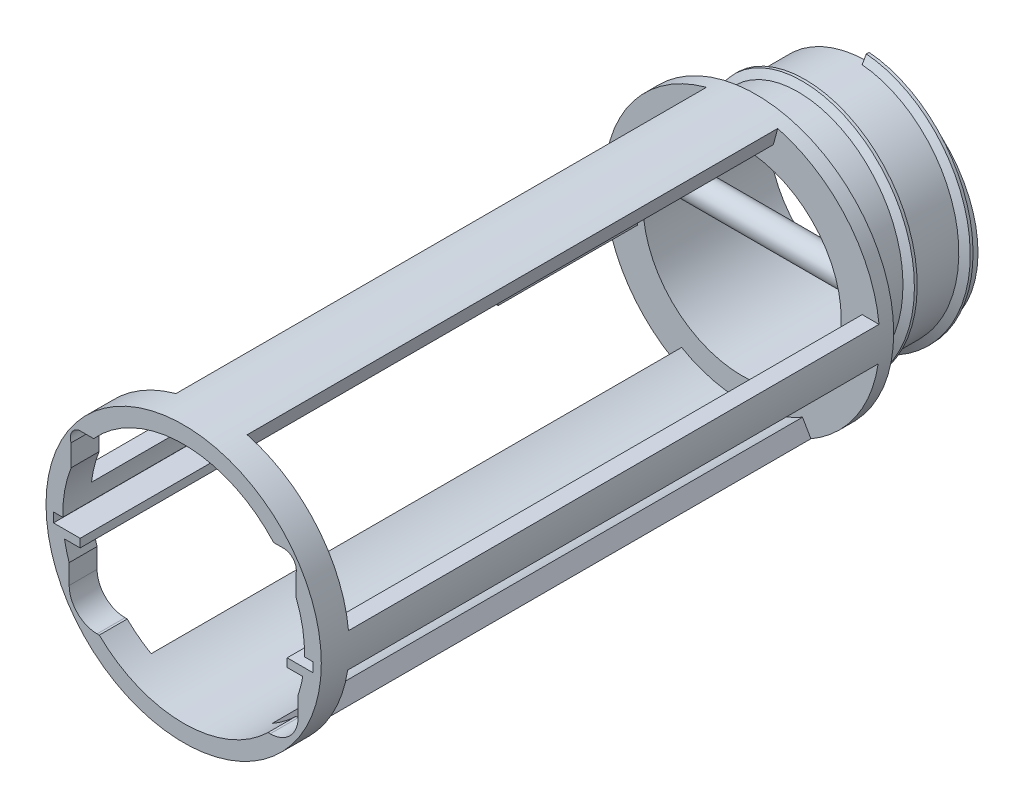
from build123d import *
from build123d.topology import SkipClean

# Parameters (mm, degrees)
SKETCH1_R                             = 19.75
SKETCH1_R_2                           = 17.75
BOSS_EXTRUDE1_DEPTH                   = 20
SKETCH2_R                             = 24.65
SKETCH2_R_2                           = 17.75
BOSS_EXTRUDE2_DEPTH                   = 2.5
SKETCH15_R                            = 24.65
SKETCH15_R_2                          = 21.65
BOSS_EXTRUDE3_DEPTH                   = 100
CUT_EXTRUDE2_START                    = -5
CUT_EXTRUDE2_DEPTH                    = 95
BOSS_EXTRUDE5_DEPTH                   = 100
SKETCH18_W                            = 46.5
SKETCH18_H                            = 1.7
CUT_EXTRUDE6_DEPTH                    = 100
BOSS_EXTRUDE11_DEPTH                  = 25
BOSS_EXTRUDE12_START                  = -100
BOSS_EXTRUDE12_DEPTH                  = 25
BOSS_EXTRUDE13_DEPTH                  = 100
CUT_EXTRUDE12_DEPTH                   = 5
CUT_EXTRUDE13_DEPTH                   = 5
BOSS_EXTRUDE16_DEPTH                  = 100
BOSS_EXTRUDE17_REACH                  = 129.364
BOSS_EXTRUDE17_END_RADIUS             = 17.75
SKETCH27_R                            = 2.3
BOSS_EXTRUDE17_DIRECTION_2_REACH      = 129.364
BOSS_EXTRUDE17_DIRECTION_2_END_RADIUS = 17.75
SWEEP1_PITCH                          = 10


with BuildPart() as part:
    # Sketch1 → Boss-Extrude1 (new body)
    with BuildSketch(Plane.XY):
        Circle(SKETCH1_R)
        Circle(SKETCH1_R_2, mode=Mode.SUBTRACT)
    extrude(amount=BOSS_EXTRUDE1_DEPTH)

    # Boss-Extrude17: up to this cylinder (the profile starts inside it)
    boss_extrude17_end = Plane(origin=(0, 0, 15), z_dir=(0, 0, -1)) * Cylinder(BOSS_EXTRUDE17_END_RADIUS, 295.228, mode=Mode.PRIVATE)
    # Sketch27 → Boss-Extrude17 (add, up to the surface)
    with BuildSketch(Plane(origin=(0, 0, 0), x_dir=(0, 0, -1), z_dir=(1, 0, 0)), mode=Mode.PRIVATE) as boss_extrude17_sk1:
        with Locations((-15, 0)):
            Circle(SKETCH27_R)
    boss_extrude17_tool1 = extrude(boss_extrude17_sk1.sketch, amount=BOSS_EXTRUDE17_REACH, mode=Mode.PRIVATE) & boss_extrude17_end
    add(boss_extrude17_tool1.solids().sort_by_distance((0, 0, 15))[0])

    # Boss-Extrude17 direction 2: up to this cylinder (the profile starts inside it)
    boss_extrude17_direction_2_end = Plane(origin=(0, 0, 15), z_dir=(0, 0, -1)) * Cylinder(BOSS_EXTRUDE17_DIRECTION_2_END_RADIUS, 295.228, mode=Mode.PRIVATE)
    # Sketch27 → Boss-Extrude17 direction 2 (add, up to the surface)
    with BuildSketch(Plane(origin=(0, 0, 0), x_dir=(0, 0, -1), z_dir=(1, 0, 0)), mode=Mode.PRIVATE) as boss_extrude17_direction_2_sk1:
        with Locations((-15, 0)):
            Circle(SKETCH27_R)
    boss_extrude17_direction_2_tool1 = extrude(boss_extrude17_direction_2_sk1.sketch, amount=-BOSS_EXTRUDE17_DIRECTION_2_REACH, mode=Mode.PRIVATE) & boss_extrude17_direction_2_end
    add(boss_extrude17_direction_2_tool1.solids().sort_by_distance((0, 0, 15))[0])



with BuildPart() as body_2:
    # Sketch2 → Boss-Extrude2 (new body)
    with BuildSketch(Plane.XY.offset(20)):
        Circle(SKETCH2_R)
        Circle(SKETCH2_R_2, mode=Mode.SUBTRACT)
    extrude(amount=BOSS_EXTRUDE2_DEPTH)

    # Sketch15 → Boss-Extrude3 (add)
    with BuildSketch(Plane.XY.offset(22.5)):
        Circle(SKETCH15_R)
        Circle(SKETCH15_R_2, mode=Mode.SUBTRACT)
    extrude(amount=BOSS_EXTRUDE3_DEPTH)

    # Sketch16 → Cut-Extrude2 (cut)
    with BuildSketch(Plane.XY.offset(122.5).offset(CUT_EXTRUDE2_START)):
        with BuildLine():
            Line((-24.522897463, -2.5), (-21.505173796, -2.5))
            ThreePointArc((-21.505173796, -2.5), (0, -21.65), (21.505173796, -2.5))
            Line((21.505173796, -2.5), (24.522897463, -2.5))
            ThreePointArc((24.522897463, -2.5), (0, -24.65), (-24.522897463, -2.5))
        make_face()
        with BuildLine():
            Line((-24.522897463, 2.5), (-21.505173796, 2.5))
            ThreePointArc((-21.505173796, 2.5), (0, 21.65), (21.505173796, 2.5))
            Line((21.505173796, 2.5), (24.522897463, 2.5))
            ThreePointArc((24.522897463, 2.5), (0, 24.65), (-24.522897463, 2.5))
        make_face()
    extrude(amount=-CUT_EXTRUDE2_DEPTH, mode=Mode.SUBTRACT)

    # Sketch19 → Boss-Extrude5 (add)
    with BuildSketch(Plane.XY.offset(122.5)):
        with BuildLine():
            Line((-12.325, -21.347526203), (-10.825, -18.749449992))
            ThreePointArc((-10.825, -18.749449992), (0, -21.65), (10.825, -18.749449992))
            Line((10.825, -18.749449992), (12.325, -21.347526203))
            ThreePointArc((12.325, -21.347526203), (0, -24.65), (-12.325, -21.347526203))
        make_face()
    extrude(amount=-BOSS_EXTRUDE5_DEPTH)

    # Sketch18 → Cut-Extrude6 (cut)
    with BuildSketch(Plane.XY.offset(122.5)):
        with Locations((-0.057052831, -1.356025124)):
            Rectangle(SKETCH18_W, SKETCH18_H)
    extrude(amount=-CUT_EXTRUDE6_DEPTH, mode=Mode.SUBTRACT)

    # Sketch22 → Boss-Extrude11 (add)
    with SkipClean():  # the faces are left unmerged after this step: merging them gives an invalid solid
        with BuildSketch(Plane.XY.offset(122.5)):
            with BuildLine():
                Line((-21.537315365, -2.206025124), (-18.537315365, -2.206025124))
                Line((-18.537315365, -2.206025124), (-18.537315365, -3.706025124))
                Line((-18.537315365, -3.706025124), (-21.330444857, -3.706025124))
                ThreePointArc((-21.330444857, -3.706025124), (-21.446997846, -2.957834239), (-21.537315365, -2.206025124))
            make_face()
            with BuildLine():
                Line((18.537315365, -3.706025124), (21.330444857, -3.706025124))
                ThreePointArc((21.330444857, -3.706025124), (21.446997846, -2.957834239), (21.537315365, -2.206025124))
                Line((21.537315365, -2.206025124), (18.537315365, -2.206025124))
                Line((18.537315365, -2.206025124), (18.537315365, -3.706025124))
            make_face()
        extrude(amount=-BOSS_EXTRUDE11_DEPTH)

    # Sketch23 → Boss-Extrude12 (add)
    with SkipClean():  # the faces are left unmerged after this step: merging them gives an invalid solid
        with BuildSketch(Plane.XY.offset(122.5).offset(BOSS_EXTRUDE12_START)):
            with BuildLine():
                Line((-22.693026531, -2.206025124), (-18.693026531, -2.206025124))
                Line((-18.693026531, -2.206025124), (-18.693026531, -3.706025124))
                Line((-18.693026531, -3.706025124), (-22.496785943, -3.706025124))
                ThreePointArc((-22.496785943, -3.706025124), (-22.607350306, -2.957653145), (-22.693026531, -2.206025124))
            make_face()
            with BuildLine():
                Line((18.693025877, -3.706025124), (22.496785943, -3.706025124))
                ThreePointArc((22.496785943, -3.706025124), (22.607350306, -2.957653145), (22.693026531, -2.206025124))
                Line((22.693026531, -2.206025124), (18.693026531, -2.206025124))
                Line((18.693026531, -2.206025124), (18.693025877, -3.706025124))
            make_face()
        extrude(amount=BOSS_EXTRUDE12_DEPTH)

    # Sketch26 → Boss-Extrude13 (add)
    with SkipClean():  # the faces are left unmerged after this step: merging them gives an invalid solid
        with BuildSketch(Plane.XY.offset(122.5)):
            with BuildLine():
                ThreePointArc((-24.644805509, -0.506025124), (-24.559483977, -2.110508655), (-24.36981489, -3.706025124))
                Line((-24.36981489, -3.706025124), (-22.496785943, -3.706025124))
                ThreePointArc((-22.496785943, -3.706025124), (-22.607350306, -2.957653145), (-22.693026531, -2.206025124))
                Line((-22.693026531, -2.206025124), (-23.307052831, -2.206025124))
                Line((-23.307052831, -2.206025124), (-23.307052831, -0.506025124))
                Line((-23.307052831, -0.506025124), (-24.644805509, -0.506025124))
            make_face()
            with BuildLine():
                ThreePointArc((22.693026531, -2.206025124), (22.607350306, -2.957653145), (22.496785943, -3.706025124))
                Line((22.496785943, -3.706025124), (24.36981489, -3.706025124))
                ThreePointArc((24.36981489, -3.706025124), (24.559483977, -2.110508655), (24.644805509, -0.506025124))
                Line((24.644805509, -0.506025124), (23.192947169, -0.506025124))
                Line((23.192947169, -0.506025124), (23.192947169, -2.206025124))
                Line((23.192947169, -2.206025124), (22.693026531, -2.206025124))
            make_face()
        extrude(amount=-BOSS_EXTRUDE13_DEPTH)

    # Sketch33 → Cut-Extrude12 (cut)
    with SkipClean():  # the faces are left unmerged after this step: merging them gives an invalid solid
        with BuildSketch(Plane.XY.offset(122.5)):
            with BuildLine():
                Line((-20.5, -10.506025124), (-20.5, -5.506025124))
                Line((-20.5, -5.506025124), (-15.5, -5.506025124))
                Line((-15.5, -5.506025124), (15.5, -5.506025124))
                Line((15.5, -5.506025124), (20.5, -5.506025124))
                Line((20.5, -5.506025124), (20.5, -10.506025124))
                ThreePointArc((20.5, -10.506025124), (19.035533906, -14.04155903), (15.5, -15.506025124))
                Line((15.5, -15.506025124), (-15.5, -15.506025124))
                ThreePointArc((-15.5, -15.506025124), (-19.035533906, -14.04155903), (-20.5, -10.506025124))
            make_face()
        extrude(amount=-CUT_EXTRUDE12_DEPTH, mode=Mode.SUBTRACT)

    # Sketch34 → Cut-Extrude13 (cut)
    with SkipClean():  # the faces are left unmerged after this step: merging them gives an invalid solid
        with BuildSketch(Plane.XY.offset(122.5)):
            with BuildLine():
                Line((17.884961769, 14.457347168), (-18.651974655, 14.457347168))
                ThreePointArc((-18.651974655, 14.457347168), (-20.041105915, 13.485698509), (-20.15, 11.793974876))
                Line((-20.15, 11.793974876), (-20.15, 3.087835606))
                Line((-20.15, 3.087835606), (20.15, 3.087835606))
                Line((20.15, 3.087835606), (20.15, 11.793974876))
                ThreePointArc((20.15, 11.793974876), (19.633100075, 13.649208183), (17.884961769, 14.457347168))
            make_face()
        extrude(amount=-CUT_EXTRUDE13_DEPTH, mode=Mode.SUBTRACT)

    # Sketch32 → Boss-Extrude16 (add)
    with SkipClean():  # the faces are left unmerged after this step: merging them gives an invalid solid
        with BuildSketch(Plane.XY.offset(122.5)):
            with BuildLine():
                Line((-5.603432326, 20.912294139), (-6.379889462, 23.810071618))
                ThreePointArc((-6.379889462, 23.810071618), (0, 24.65), (6.379889462, 23.810071618))
                Line((6.379889462, 23.810071618), (5.603432326, 20.912294139))
                ThreePointArc((5.603432326, 20.912294139), (2.825892062, 21.464781249), (0, 21.65))
                ThreePointArc((0, 21.65), (-2.825892062, 21.464781249), (-5.603432326, 20.912294139))
            make_face()
        extrude(amount=-BOSS_EXTRUDE16_DEPTH)
    add(body_2.part.scale(1), mode=Mode.REPLACE)  # the faces are merged on a copy


with BuildPart() as part_1:
    add(part.part)

    add(body_2.part)  # Sweep1 merges body 2
    # Sweep1: the profile of Sketch36 profile screwed along a left-hand helix of 2 turns, 16 arcs to a turn; built about Z, then put on its axis
    sweep1_z = Axis((0, 0, 0), (0, 0, 1))
    sweep1_corners = [(19.7497, 0, 1.000173205), (21.049038106, 0, 0.25), (21.049038106, 0, -0.25), (19.7497, 0, -1.000173205)]
    with BuildLine(mode=Mode.PRIVATE) as sweep1_profile:
        Line(sweep1_corners[0], sweep1_corners[1])
        Line(sweep1_corners[1], sweep1_corners[2])
        Line(sweep1_corners[2], sweep1_corners[3])
        Line(sweep1_corners[3], sweep1_corners[0])
    sweep1_cap = Face(sweep1_profile.wire())
    sweep1_turn_angles = [0, -11.25, -22.5, -33.75, -45, -56.25, -67.5, -78.75, -90, -101.25, -112.5, -123.75, -135, -146.25, -157.5, -168.75, -180, -191.25, -202.5, -213.75, -225, -236.25, -247.5, -258.75, -270, -281.25, -292.5, -303.75, -315, -326.25, -337.5, -348.75, -360]
    sweep1_turn_weights = [1, 0.9807852804032304, 1, 0.9807852804032304, 1, 0.9807852804032304, 1, 0.9807852804032304, 1, 0.9807852804032304, 1, 0.9807852804032304, 1, 0.9807852804032304, 1, 0.9807852804032304, 1, 0.9807852804032304, 1, 0.9807852804032304, 1, 0.9807852804032304, 1, 0.9807852804032304, 1, 0.9807852804032304, 1, 0.9807852804032304, 1, 0.9807852804032304, 1, 0.9807852804032304, 1]
    sweep1_turn_rails = [Edge.make_bspline([Vector(p[0], p[1], 0).rotate(sweep1_z, sweep1_turn_angles[k]) / sweep1_turn_weights[k] + Vector(0, 0, p[2] + -SWEEP1_PITCH * sweep1_turn_angles[k] / 360) for k in range(33)], [0, 0, 0, 1, 1, 2, 2, 3, 3, 4, 4, 5, 5, 6, 6, 7, 7, 8, 8, 9, 9, 10, 10, 11, 11, 12, 12, 13, 13, 14, 14, 15, 15, 16, 16, 16], 2, sweep1_turn_weights) for p in sweep1_corners]
    sweep1_turn_sides = [Face.make_surface_from_curves(sweep1_turn_rails[p[0]], sweep1_turn_rails[p[1]]) for p in [(0, 1), (1, 2), (2, 3), (3, 0)]]
    sweep1 = Plane(origin=(0, 0, 0), x_dir=(0, 1, 0), z_dir=(0, 0, 1)) * Solid(Shell([*[p.moved(Location((0, 0, SWEEP1_PITCH * i))) for i in range(2) for p in sweep1_turn_sides], sweep1_cap, sweep1_cap.rotate(sweep1_z, -720).moved(Location((0, 0, -SWEEP1_PITCH * -720 / 360)))]))
    add(sweep1)


solid = part_1.part
